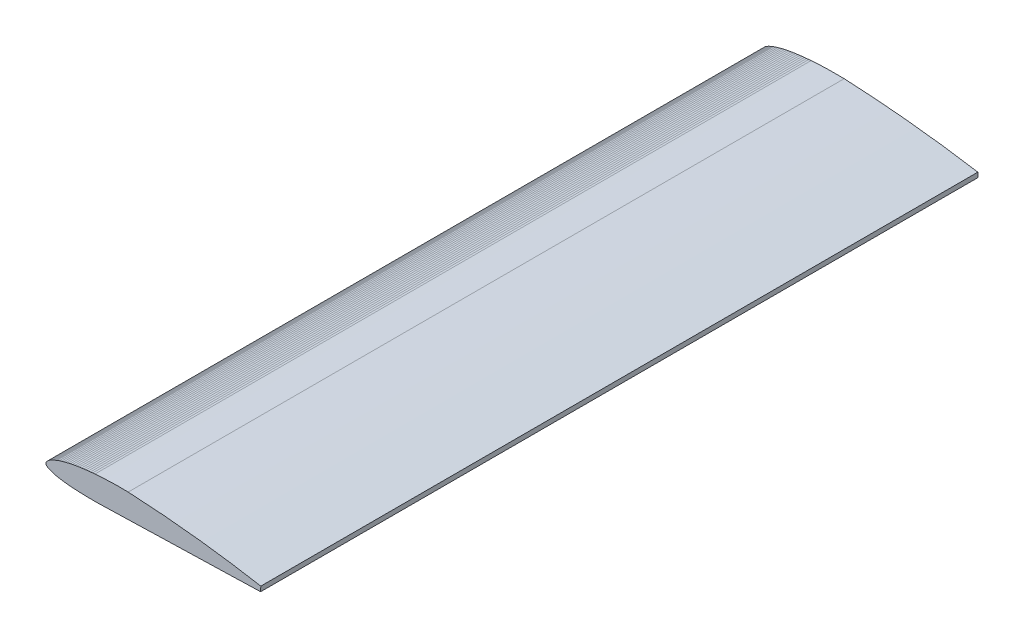
from build123d import *

# Parameters (mm, degrees)
EXTRUDE_1_DEPTH     = 596
CUT_EXTRUDE_1_DEPTH = 200


# Read off the part's stored shape, not the designer's step: 凸台-拉伸1
with BuildPart() as part:
    # 凸台-拉伸1 outline → 凸台-拉伸1 (new body)
    with BuildSketch(Plane.XY):
        with BuildLine():
            ThreePointArc((623.153277806, 214.044502024), (622.809045542, 212.606641554), (623.403040298, 211.252718066))
            Line((623.403040298, 211.252718066), (623.613974796, 211.083132462))
            Line((623.613974796, 211.083132462), (623.797974796, 210.950402462))
            Line((623.797974796, 210.950402462), (623.981974796, 210.827436462))
            Line((623.981974796, 210.827436462), (624.165974796, 210.711210462))
            Line((624.165974796, 210.711210462), (624.349974796, 210.600171462))
            Line((624.349974796, 210.600171462), (624.533974796, 210.494320462))
            Line((624.533974796, 210.494320462), (624.717974796, 210.393315462))
            Line((624.717974796, 210.393315462), (624.901974796, 210.296526462))
            Line((624.901974796, 210.296526462), (625.085974796, 210.203333462))
            Line((625.085974796, 210.203333462), (625.269974796, 210.113807462))
            Line((625.269974796, 210.113807462), (625.453974796, 210.027648462))
            Line((625.453974796, 210.027648462), (625.637974796, 209.944150462))
            Line((625.637974796, 209.944150462), (625.821974796, 209.862832462))
            Line((625.821974796, 209.862832462), (626.005974796, 209.783531462))
            Line((626.005974796, 209.783531462), (626.189974796, 209.706043462))
            Line((626.189974796, 209.706043462), (626.373974796, 209.630454462))
            Line((626.373974796, 209.630454462), (626.557974796, 209.556778462))
            Line((626.557974796, 209.556778462), (626.741974796, 209.485025462))
            Line((626.741974796, 209.485025462), (626.925974796, 209.415202462))
            Line((626.925974796, 209.415202462), (627.109974796, 209.347318462))
            Line((627.109974796, 209.347318462), (627.293974796, 209.281379462))
            Line((627.293974796, 209.281379462), (627.477974796, 209.217149462))
            Line((627.477974796, 209.217149462), (627.661974796, 209.153826462))
            Line((627.661974796, 209.153826462), (627.845974796, 209.091500462))
            Line((627.845974796, 209.091500462), (628.029974796, 209.030400462))
            Line((628.029974796, 209.030400462), (628.213974796, 208.970758462))
            Line((628.213974796, 208.970758462), (628.397974796, 208.912803462))
            Line((628.397974796, 208.912803462), (628.581974796, 208.856766462))
            Line((628.581974796, 208.856766462), (628.765974796, 208.802876462))
            Line((628.765974796, 208.802876462), (628.949974796, 208.751221462))
            Line((628.949974796, 208.751221462), (629.133974796, 208.701043462))
            Line((629.133974796, 208.701043462), (629.317974796, 208.652259462))
            Line((629.317974796, 208.652259462), (629.501974796, 208.604947462))
            Line((629.501974796, 208.604947462), (629.685974796, 208.559004462))
            Line((629.685974796, 208.559004462), (629.869974796, 208.514136462))
            Line((629.869974796, 208.514136462), (630.053974796, 208.470267462))
            Line((630.053974796, 208.470267462), (630.237974796, 208.427325462))
            Line((630.237974796, 208.427325462), (630.421974796, 208.385235462))
            Line((630.421974796, 208.385235462), (630.605974796, 208.343924462))
            Line((630.605974796, 208.343924462), (630.789974796, 208.303321462))
            Line((630.789974796, 208.303321462), (630.973974796, 208.263351462))
            Line((630.973974796, 208.263351462), (631.157974796, 208.223941462))
            Line((631.157974796, 208.223941462), (631.341974796, 208.185019462))
            Line((631.341974796, 208.185019462), (631.525974796, 208.146511462))
            Line((631.525974796, 208.146511462), (631.709974796, 208.108344462))
            Line((631.709974796, 208.108344462), (633.549974796, 207.743092462))
            Line((633.549974796, 207.743092462), (635.389974796, 207.428703462))
            Line((635.389974796, 207.428703462), (637.229974796, 207.171560462))
            Line((637.229974796, 207.171560462), (639.069974796, 206.949657462))
            Line((639.069974796, 206.949657462), (640.909974796, 206.758797462))
            Line((640.909974796, 206.758797462), (642.749974796, 206.595301462))
            Line((642.749974796, 206.595301462), (644.589974796, 206.451126462))
            Line((644.589974796, 206.451126462), (646.429974796, 206.329230462))
            Line((646.429974796, 206.329230462), (648.269974796, 206.224689462))
            Line((648.269974796, 206.224689462), (650.109974796, 206.134408462))
            Line((650.109974796, 206.134408462), (651.949974796, 206.063776462))
            Line((651.949974796, 206.063776462), (653.789974796, 206.007873462))
            Line((653.789974796, 206.007873462), (655.629974796, 205.959453462))
            Line((655.629974796, 205.959453462), (657.469974796, 205.920663462))
            Line((657.469974796, 205.920663462), (659.309974796, 205.890235462))
            Line((659.309974796, 205.890235462), (661.149974796, 205.870136462))
            Line((661.149974796, 205.870136462), (662.989974796, 205.861374462))
            Line((662.989974796, 205.861374462), (665.577369983, 205.859111897))
            Line((665.577369983, 205.859111897), (801.153277806, 209.539214658))
            Line((801.153277806, 209.539214658), (801.153277806, 213.540688004))
            ThreePointArc((801.153277806, 213.540688004), (746.057515046, 221.296405936), (690.591386195, 225.678504181))
            ThreePointArc((690.591386195, 225.678504181), (676.810819554, 225.656464203), (663.050912758, 224.901833394))
            Line((663.050912758, 224.901833394), (661.149974796, 224.742524462))
            Line((661.149974796, 224.742524462), (659.309974796, 224.570018462))
            Line((659.309974796, 224.570018462), (657.469974796, 224.381927462))
            Line((657.469974796, 224.381927462), (655.629974796, 224.177253462))
            Line((655.629974796, 224.177253462), (653.789974796, 223.956962462))
            Line((653.789974796, 223.956962462), (651.949974796, 223.720336462))
            Line((651.949974796, 223.720336462), (650.109974796, 223.460943462))
            Line((650.109974796, 223.460943462), (648.269974796, 223.178033462))
            Line((648.269974796, 223.178033462), (646.429974796, 222.872007462))
            Line((646.429974796, 222.872007462), (644.589974796, 222.538028462))
            Line((644.589974796, 222.538028462), (642.749974796, 222.175420462))
            Line((642.749974796, 222.175420462), (640.909974796, 221.781914462))
            Line((640.909974796, 221.781914462), (639.069974796, 221.349163462))
            Line((639.069974796, 221.349163462), (637.229974796, 220.876771462))
            Line((637.229974796, 220.876771462), (635.389974796, 220.363377462))
            Line((635.389974796, 220.363377462), (633.549974796, 219.784146462))
            Line((633.549974796, 219.784146462), (631.709974796, 219.132497462))
            Line((631.709974796, 219.132497462), (631.525974796, 219.061910462))
            Line((631.525974796, 219.061910462), (631.341974796, 218.990200462))
            Line((631.341974796, 218.990200462), (631.157974796, 218.917449462))
            Line((631.157974796, 218.917449462), (630.973974796, 218.843741462))
            Line((630.973974796, 218.843741462), (630.789974796, 218.769158462))
            Line((630.789974796, 218.769158462), (630.605974796, 218.693784462))
            Line((630.605974796, 218.693784462), (630.421974796, 218.617701462))
            Line((630.421974796, 218.617701462), (630.237974796, 218.540992462))
            Line((630.237974796, 218.540992462), (630.053974796, 218.463740462))
            Line((630.053974796, 218.463740462), (629.869974796, 218.386027462))
            Line((629.869974796, 218.386027462), (629.685974796, 218.307937462))
            Line((629.685974796, 218.307937462), (629.501974796, 218.229554462))
            Line((629.501974796, 218.229554462), (629.317974796, 218.151037462))
            Line((629.317974796, 218.151037462), (629.133974796, 218.072325462))
            Line((629.133974796, 218.072325462), (628.949974796, 217.993241462))
            Line((628.949974796, 217.993241462), (628.765974796, 217.913445462))
            Line((628.765974796, 217.913445462), (628.581974796, 217.831925462))
            Line((628.581974796, 217.831925462), (628.397974796, 217.748512462))
            Line((628.397974796, 217.748512462), (628.213974796, 217.663181462))
            Line((628.213974796, 217.663181462), (628.029974796, 217.575908462))
            Line((628.029974796, 217.575908462), (627.845974796, 217.486665462))
            Line((627.845974796, 217.486665462), (627.661974796, 217.395430462))
            Line((627.661974796, 217.395430462), (627.477974796, 217.302175462))
            Line((627.477974796, 217.302175462), (627.293974796, 217.207062462))
            Line((627.293974796, 217.207062462), (627.109974796, 217.110472462))
            Line((627.109974796, 217.110472462), (626.925974796, 217.012001462))
            Line((626.925974796, 217.012001462), (626.741974796, 216.911309462))
            Line((626.741974796, 216.911309462), (626.557974796, 216.808051462))
            Line((626.557974796, 216.808051462), (626.373974796, 216.701887462))
            Line((626.373974796, 216.701887462), (626.189974796, 216.592474462))
            Line((626.189974796, 216.592474462), (626.005974796, 216.479477462))
            Line((626.005974796, 216.479477462), (625.821974796, 216.362633462))
            Line((625.821974796, 216.362633462), (625.637974796, 216.241378462))
            Line((625.637974796, 216.241378462), (625.453974796, 216.113750462))
            Line((625.453974796, 216.113750462), (625.269974796, 215.978916462))
            Line((625.269974796, 215.978916462), (625.085974796, 215.837398462))
            Line((625.085974796, 215.837398462), (624.901974796, 215.690124462))
            Line((624.901974796, 215.690124462), (624.717974796, 215.538392462))
            Line((624.717974796, 215.538392462), (624.533974796, 215.382813462))
            Line((624.533974796, 215.382813462), (624.349974796, 215.223983462))
            Line((624.349974796, 215.223983462), (624.165974796, 215.061872462))
            Line((624.165974796, 215.061872462), (623.981974796, 214.894377462))
            Line((623.981974796, 214.894377462), (623.797974796, 214.721113462))
            Line((623.797974796, 214.721113462), (623.613974796, 214.540556462))
            Line((623.613974796, 214.540556462), (623.429974796, 214.348769462))
            Line((623.429974796, 214.348769462), (623.153277806, 214.044502024))
        make_face()
    extrude(amount=EXTRUDE_1_DEPTH)

    # 草图3 → 切除-拉伸1 (cut)
    with BuildSketch(Plane(origin=(801.153277806, 0, 0), x_dir=(0, 0, -1), z_dir=(1, 0, 0))):
        Polygon((-596, 227.293276395), (-596, 205.859111897), (-595.251502482, 227.293276395), align=None)
        Polygon((0, 205.859111897), (0, 226.731632729), (-0.728884489, 226.731632729), align=None)
    extrude(amount=-CUT_EXTRUDE_1_DEPTH, mode=Mode.SUBTRACT)


solid = part.part
